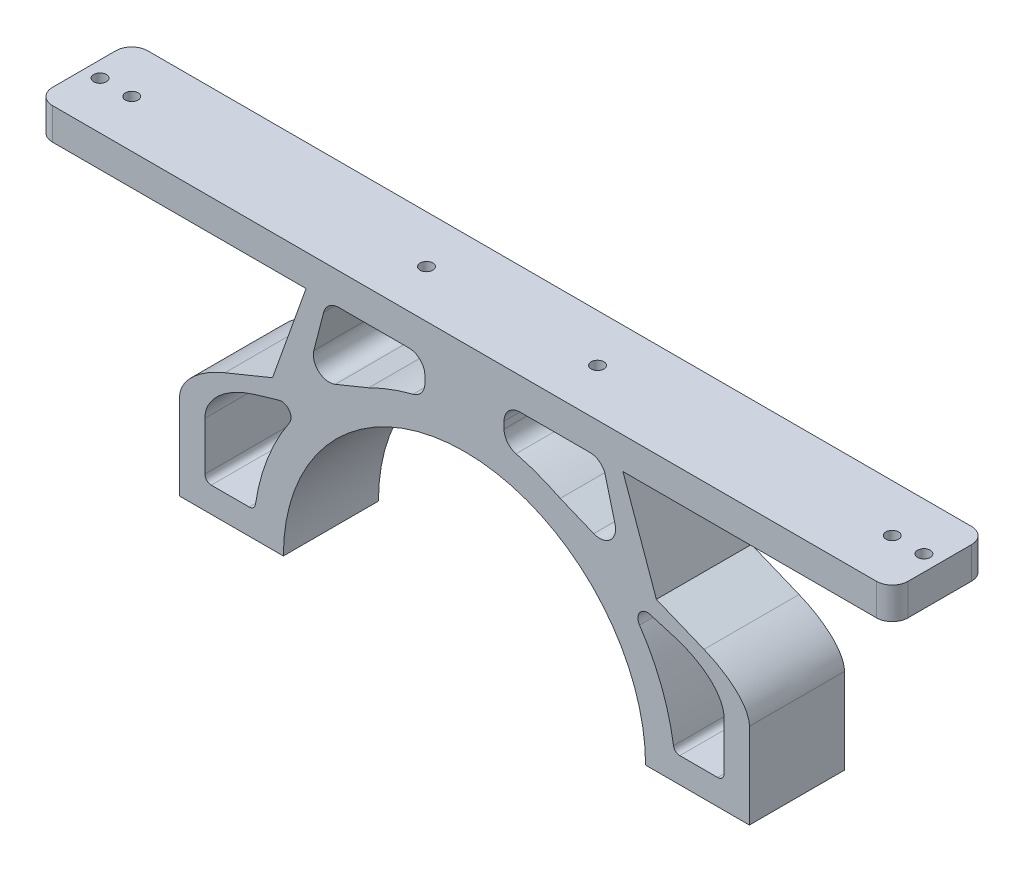
from build123d import *

# Parameters (mm, degrees)
BOSS_EXTRUDE1_DEPTH = 30
SKETCH2_W           = 20
SKETCH2_H           = 8
BOSS_EXTRUDE2_DEPTH = 30
BOSS_EXTRUDE3_DEPTH = 30
SKETCH5_R           = 2.778125
CUT_EXTRUDE2_DEPTH  = 112.476514483
FILLET6_R           = 2
FILLET8_R           = 3
BOSS_EXTRUDE4_START = -30
SKETCH6_W           = 100
SKETCH6_H           = 10
BOSS_EXTRUDE4_DEPTH = 30
FILLET9_R           = 5
FILLET10_R          = 5
SKETCH7_W           = 270
SKETCH7_H           = 10
BOSS_EXTRUDE5_DEPTH = 30
SKETCH8_R           = 2
CUT_EXTRUDE3_DEPTH  = 30
FILLET11_R          = 5
SKETCH9_R           = 2
CUT_EXTRUDE4_DEPTH  = 13.175


with BuildPart() as part:
    # Sketch1 → Boss-Extrude1 (new body)
    with BuildSketch(Plane.XY):
        with BuildLine():
            ThreePointArc((66.675, 0), (0, 66.675), (-66.675, 0))
            Line((-66.675, 0), (-57.15, 0))
            ThreePointArc((-57.15, 0), (0, 57.15), (57.15, 0))
            Line((57.15, 0), (66.675, 0))
        make_face()
    extrude(amount=BOSS_EXTRUDE1_DEPTH)

    # Sketch2 → Boss-Extrude2 (add)
    with BuildSketch(Plane.XY.offset(30)):
        with Locations((-71.9125, 4)):
            Rectangle(SKETCH2_W, SKETCH2_H)
        with Locations((71.9125, 4)):
            Rectangle(SKETCH2_W, SKETCH2_H)
    extrude(amount=-BOSS_EXTRUDE2_DEPTH)

    # Sketch4 → Boss-Extrude3 (add)
    with BuildSketch(Plane.XY.offset(30)):
        Polygon((-89.9125, 0), (-81.9125, 0), (-81.9125, 35), (-40.473552557, 47.215668719), (-30.223695263, 59.431337438), (-89.9125, 35), align=None)
        Polygon((30.223695263, 59.431337438), (40.473552557, 47.215668719), (81.9125, 35), (81.9125, 0), (89.9125, 0), (89.9125, 35), align=None)
    extrude(amount=-BOSS_EXTRUDE3_DEPTH)

    # Sketch5 → Cut-Extrude2 (cut, through all)
    with BuildSketch(Plane(origin=(0, 8, 0), x_dir=(1, 0, 0), z_dir=(0, 1, 0))):
        with Locations(Location((-74.052910047, -15, 0), (0, 0, 180))):
            Circle(SKETCH5_R)
        with Locations((74.052910047, -15)):
            Circle(SKETCH5_R)
    extrude(amount=-CUT_EXTRUDE2_DEPTH, mode=Mode.SUBTRACT)

    # Fillet6
    fillet6_edges = [part.edges().sort_by_distance(p)[0] for p in [
        (-81.9125, 8, 15),
        (-66.193320093, 8, 15),
        (66.193320093, 8, 15),
        (81.9125, 8, 15),
    ]]
    fillet(fillet6_edges, radius=FILLET6_R)

    # Fillet7
    # a fillet whose section is not a circle: 20, 15 mm, written as the material it adds along each edge
    with BuildSketch(Plane(origin=(81.9125, 35, 30), x_dir=(-0.9591914836749359, 0.28275731227587253, 0), z_dir=(0, 0, -1))) as fillet7_piece_1:
        with BuildLine():
            Bezier((16.42908698, 0), (0, 0), (-2.754742693, -9.344853754), weights=[1, 0.800861197, 1])
            Line((-2.754742693, -9.344853754), (0, 0))
            Line((0, 0), (16.42908698, 0))
        make_face()
    extrude(amount=30)
    with BuildSketch(Plane(origin=(-81.9125, 35, 30), x_dir=(0, -1, 0), z_dir=(0, 0, -1))) as fillet7_piece_2:
        with BuildLine():
            Bezier((9.742427777, 0), (0, 0), (-4.645444478, -15.758640316), weights=[1, 0.800861197, 1])
            Line((-4.645444478, -15.758640316), (0, 0))
            Line((0, 0), (9.742427777, 0))
        make_face()
    extrude(amount=30)
    # a fillet whose section is not a circle: 20, 15 mm, written as the material it takes off along each edge
    with BuildSketch(Plane(origin=(89.9125, 35, 68.677099201), x_dir=(0, -1, 0), z_dir=(0, 0, -1))) as fillet7_2_piece_1:
        with BuildLine():
            Bezier((8.021650729, 0), (0, 0), (-5.860478322, 14.317879531), weights=[1, 0.830303568, 1])
            Line((-5.860478322, 14.317879531), (0, 0))
            Line((0, 0), (8.021650729, 0))
        make_face()
    extrude(amount=107.354198402, mode=Mode.SUBTRACT)
    with BuildSketch(Plane(origin=(-89.9125, 35, 68.677099201), x_dir=(0.9254752700268907, 0.37880803128847984, 0), z_dir=(0, 0, -1))) as fillet7_2_piece_2:
        with BuildLine():
            Bezier((15.47083968, 0), (0, 0), (-3.03866572, 7.423839374), weights=[1, 0.830303568, 1])
            Line((-3.03866572, 7.423839374), (0, 0))
            Line((0, 0), (15.47083968, 0))
        make_face()
    extrude(amount=107.354198402, mode=Mode.SUBTRACT)

    # Fillet8
    fillet8_edges = [part.edges().sort_by_distance(p)[0] for p in [
        (-49.639626869, 44.513627906, 15),
        (49.639626869, 44.513627906, 15),
    ]]
    fillet(fillet8_edges, radius=FILLET8_R)

    # Sketch6 → Boss-Extrude4 (add)
    with BuildSketch(Plane.XY.offset(30).offset(BOSS_EXTRUDE4_START)):
        with Locations((0, 81.675)):
            Rectangle(SKETCH6_W, SKETCH6_H)
        Polygon((-43.476507509, 76.675), (-50, 76.675), (-60.5630878, 47.013063358), (-50.022382459, 51.327499376), align=None)
        with BuildLine():
            Line((12.5, 76.675), (-12.5, 76.675))
            Line((-12.5, 76.675), (-12.5, 65.492790634))
            ThreePointArc((-12.5, 65.492790634), (0, 66.675), (12.5, 65.492790634))
            Line((12.5, 65.492790634), (12.5, 76.675))
        make_face()
        Polygon((60.5630878, 47.013063358), (50, 76.675), (43.476507509, 76.675), (50.022382459, 51.327499376), align=None)
    extrude(amount=BOSS_EXTRUDE4_DEPTH)

    # Fillet9
    fillet9_edges = [part.edges().sort_by_distance(p)[0] for p in [
        (43.476507509, 76.675, 15),
        (12.5, 76.675, 15),
        (12.5, 65.492790634, 15),
        (-12.5, 65.492790634, 15),
        (-12.5, 76.675, 15),
        (-43.476507509, 76.675, 15),
    ]]
    fillet(fillet9_edges, radius=FILLET9_R)

    # Fillet10
    fillet10_edges = [part.edges().sort_by_distance(p)[0] for p in [
        (-50.022382459, 51.327499376, 15),
        (50.022382459, 51.327499376, 15),
    ]]
    fillet(fillet10_edges, radius=FILLET10_R)

    # Sketch7 → Boss-Extrude5 (add)
    with BuildSketch(Plane.XY.offset(30)):
        with Locations((0, 81.675)):
            Rectangle(SKETCH7_W, SKETCH7_H)
    extrude(amount=-BOSS_EXTRUDE5_DEPTH)

    # Sketch8 → Cut-Extrude3 (cut)
    with BuildSketch(Plane(origin=(0, 86.675, 0), x_dir=(1, 0, 0), z_dir=(0, 1, 0))):
        with Locations(Location((130, -15, 0), (0, 0, 180))):
            Circle(SKETCH8_R)
        with Locations(Location((120, -15, 0), (0, 0, 180))):
            Circle(SKETCH8_R)
        with Locations(Location((-120, -15, 0), (0, 0, 90))):
            Circle(SKETCH8_R)
        with Locations(Location((-130, -15, 0), (0, 0, 90))):
            Circle(SKETCH8_R)
    extrude(amount=-CUT_EXTRUDE3_DEPTH, mode=Mode.SUBTRACT)

    # Fillet11
    fillet11_edges = [part.edges().sort_by_distance(p)[0] for p in [
        (135, 81.675, 30),
        (-135, 81.675, 0),
        (135, 81.675, 0),
        (-135, 81.675, 30),
    ]]
    fillet(fillet11_edges, radius=FILLET11_R)

    # Sketch9 → Cut-Extrude4 (cut)
    with BuildSketch(Plane(origin=(0, 86.675, 0), x_dir=(1, 0, 0), z_dir=(0, 1, 0))):
        with Locations(Location((27, -15, 0), (0, 0, 180))):
            Circle(SKETCH9_R)
        with Locations(Location((-27, -15, 0), (0, 0, 180))):
            Circle(SKETCH9_R)
    extrude(amount=-CUT_EXTRUDE4_DEPTH, mode=Mode.SUBTRACT)


solid = part.part
